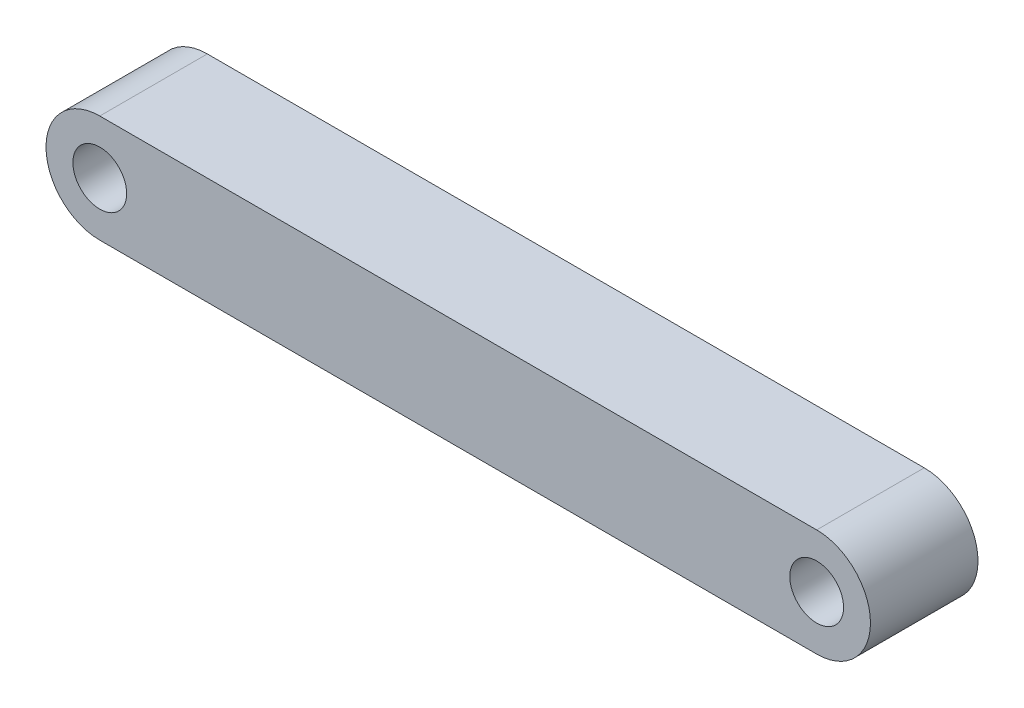
from build123d import *

# Parameters (mm, degrees)
BOSS_EXTRU_1_DEPTH      = 3
BOSS_EXTRU_1_DEPTH_BACK = 3
ESQUISSE1_R             = 1.5


with BuildPart() as part:
    # Esquisse1 → Boss.-Extru.1 (new, two sides: drawn at the far end of the back side and taken through both)
    with BuildSketch(Plane.XY.offset(-BOSS_EXTRU_1_DEPTH_BACK)):
        with BuildLine():
            Line((0, 3), (40, 3))
            ThreePointArc((40, 3), (43, 0), (40, -3))
            Line((40, -3), (0, -3))
            ThreePointArc((0, -3), (-3, 0), (0, 3))
        make_face()
        Circle(ESQUISSE1_R, mode=Mode.SUBTRACT)
        with Locations((40, 0)):
            Circle(ESQUISSE1_R, mode=Mode.SUBTRACT)
    extrude(amount=BOSS_EXTRU_1_DEPTH + BOSS_EXTRU_1_DEPTH_BACK)


solid = part.part
